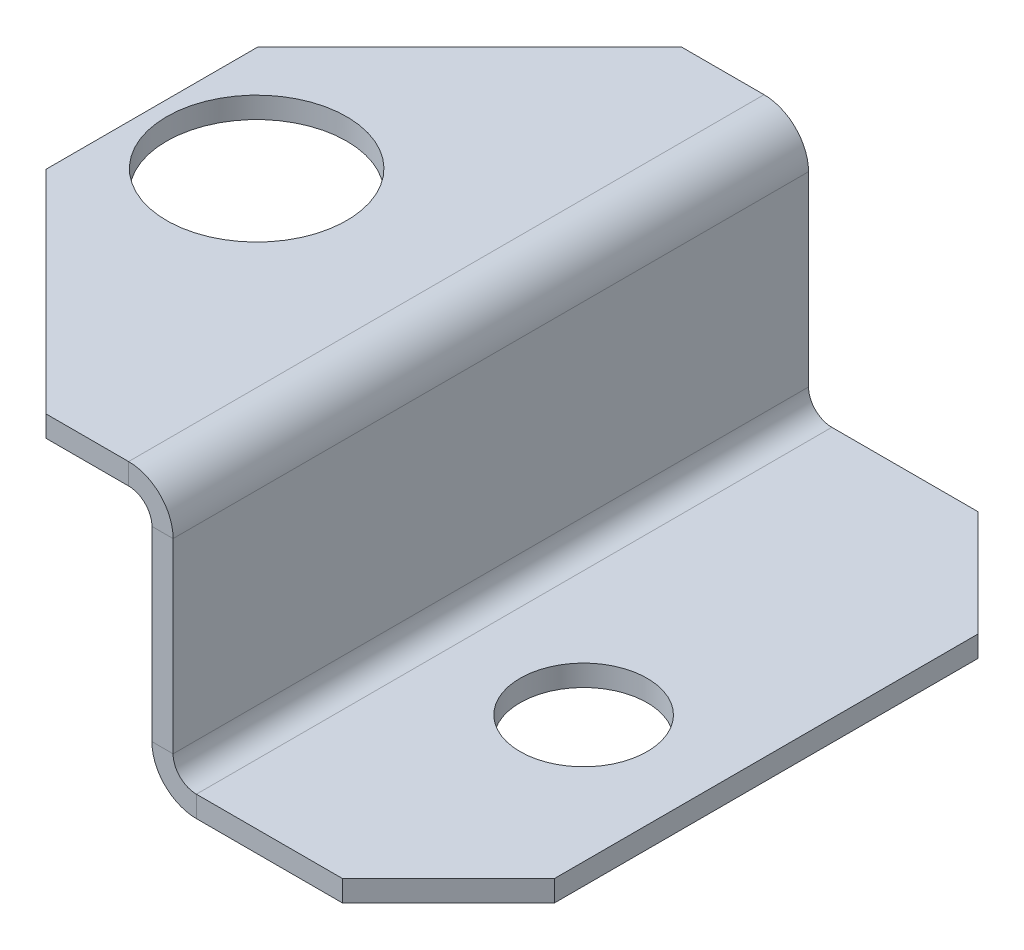
from build123d import *

# Parameters (mm, degrees)
SM_BASE_FLANGE_1_DEPTH           = 30
SKETCH_5_R                       = 3
CUT_EXTRUDE_3_DEPTH              = 10
SM_EDGE_FLANGE_1_STRIP_W         = 6.2
SM_EDGE_FLANGE_1_STRIP_H         = 1
SM_EDGE_FLANGE_1_STRIP_CUT_DEPTH = 30
SM_EDGE_FLANGE_1_DEPTH           = 30
CHAMFER_1_SIZE                   = 10
SKETCH_10_R                      = 4.25
CUT_EXTRUDE_4_DEPTH              = 10
CHAMFER_2_SIZE                   = 5


# Sheet-metal steps are written as plain solids
with BuildPart() as part:
    # Sketch 1 → Базовая кромка1 (new body)
    with BuildSketch(Plane.XY):
        with BuildLine():
            Line((0, 12), (0, 1.1))
            ThreePointArc((0, 1.1), (0.322182541, 0.322182541), (1.1, 0))
            Line((1.1, 0), (13, 0))
            Line((13, 0), (13, -1))
            Line((13, -1), (1.1, -1))
            ThreePointArc((1.1, -1), (-0.38492424, -0.38492424), (-1, 1.1))
            Line((-1, 1.1), (-1, 12))
            Line((-1, 12), (0, 12))
        make_face()
    extrude(amount=SM_BASE_FLANGE_1_DEPTH)

    # Эскиз5 → Вырез-Вытянуть3 (cut)
    with BuildSketch(Plane(origin=(0, 0, 0), x_dir=(1, 0, 0), z_dir=(0, 1, 0))):
        with Locations(Location((7, -17.618648825, 0), (0, 0, 270))):
            Circle(SKETCH_5_R)
    extrude(amount=-CUT_EXTRUDE_3_DEPTH, mode=Mode.SUBTRACT)

    # Ребро-кромка1 strip (across the edge) → Ребро-кромка1 strip cut (cut)
    with BuildSketch(Plane(origin=(-1, 12, 30), x_dir=(0, -1, 0), z_dir=(0, 0, -1))):
        with Locations((-1, -0.5)):
            Rectangle(SM_EDGE_FLANGE_1_STRIP_W, SM_EDGE_FLANGE_1_STRIP_H)
    extrude(amount=SM_EDGE_FLANGE_1_STRIP_CUT_DEPTH, mode=Mode.SUBTRACT)

    # Ребро-кромка1 section (across the edge) → Ребро-кромка1 (add)
    with BuildSketch(Plane(origin=(-1, 12, 30), x_dir=(0, -1, 0), z_dir=(0, 0, -1))):
        with BuildLine():
            Line((0, 1.1), (0, 15))
            Line((0, 15), (1, 15))
            Line((1, 15), (1, 1.1))
            ThreePointArc((1, 1.1), (1.322182541, 0.322182541), (2.1, 0))
            Line((2.1, 0), (2.1, -1))
            ThreePointArc((2.1, -1), (0.61507576, -0.38492424), (0, 1.1))
        make_face()
    extrude(amount=SM_EDGE_FLANGE_1_DEPTH)

    # Фаска1
    chamfer_1_edges = [part.edges().sort_by_distance(p)[0] for p in [
        (-16, 11.5, 30),
        (-16, 11.5, 0),
    ]]
    chamfer(chamfer_1_edges, length=CHAMFER_1_SIZE)

    # Эскиз10 → Вырез-Вытянуть4 (cut)
    with BuildSketch(Plane(origin=(0, 12, 0), x_dir=(1, 0, 0), z_dir=(0, 1, 0))):
        with Locations(Location((-11.054624514, -15, 0), (0, 0, 180))):
            Circle(SKETCH_10_R)
    extrude(amount=-CUT_EXTRUDE_4_DEPTH, mode=Mode.SUBTRACT)

    # Фаска2
    chamfer_2_edges = [part.edges().sort_by_distance(p)[0] for p in [
        (13, -0.5, 30),
        (13, -0.5, 0),
    ]]
    chamfer(chamfer_2_edges, length=CHAMFER_2_SIZE)


solid = part.part
